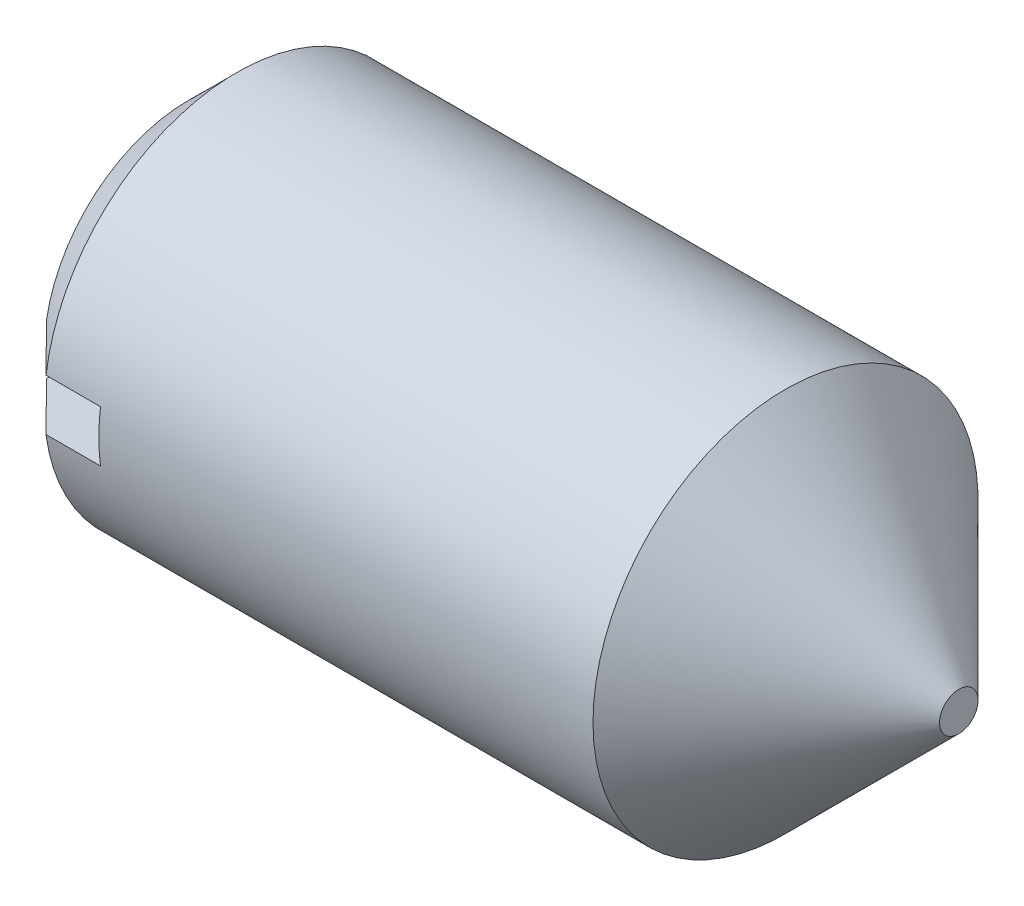
from build123d import *

# Parameters (mm, degrees)
NOTCH_DEPTH      = 7.363961031
NOTCH_DEPTH_BACK = 7.363961031
SKETCH2_W        = 0.8
SKETCH2_H        = 0.4


with BuildPart() as part:
    # Sketch1 → Base (revolve)
    with BuildSketch(Plane.XY):
        Polygon((0, 0), (6, 0), (6, 0.15), (4.65, 1.5), (0.375, 1.5), (0, 1.125), align=None)
    revolve(axis=Axis((-14.774129749, 0, 0), (1, 0, 0)))

    # Sketch2 → Notch (cut, two sides: drawn at the far end of the back side and taken through both)
    with BuildSketch(Plane.XY.offset(-NOTCH_DEPTH_BACK)):
        with Locations((0.4, 0)):
            Rectangle(SKETCH2_W, SKETCH2_H)
    extrude(amount=NOTCH_DEPTH + NOTCH_DEPTH_BACK, mode=Mode.SUBTRACT)


solid = part.part
